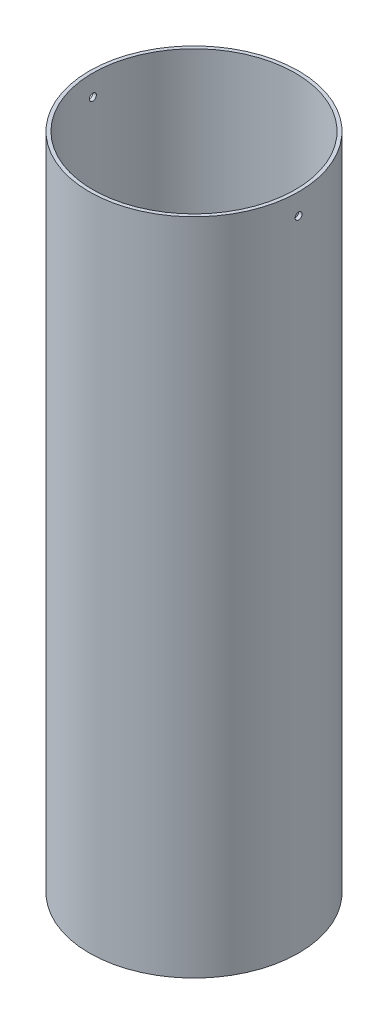
from build123d import *

# Parameters (mm, degrees)
SKETCH1_W               = 3.175
SKETCH1_H               = 600
CUT_EXTRUDE1_REACH      = 638.681
CUT_EXTRUDE1_END_RADIUS = 92.075
SKETCH3_R               = 3.175
CIRPATTERN1_COUNT       = 2


with BuildPart() as part:
    # Sketch1 → Revolve1 (revolve)
    with BuildSketch(Plane.XY):
        with Locations((93.6625, 300)):
            Rectangle(SKETCH1_W, SKETCH1_H)
    revolve(axis=Axis((0, 0, 0), (0, 1, 0)))

    # Cut-Extrude1: up to this cylinder (the profile starts outside it)
    cut_extrude1_end = Plane(origin=(0, 580.95, 0), z_dir=(0, -1, 0)) * Cylinder(CUT_EXTRUDE1_END_RADIUS, 1462.512, mode=Mode.PRIVATE)
    # Sketch3 → Cut-Extrude1 (cut, up to the surface)
    with BuildSketch(Plane(origin=(95.25, 0, 0), x_dir=(0, 0, -1), z_dir=(1, 0, 0)), mode=Mode.PRIVATE) as cut_extrude1_sk1:
        with Locations((0, 580.95)):
            Circle(SKETCH3_R)
    cut_extrude1_tool1 = extrude(cut_extrude1_sk1.sketch, amount=-CUT_EXTRUDE1_REACH, mode=Mode.PRIVATE) - cut_extrude1_end
    cut_extrude1 = cut_extrude1_tool1.solids().sort_by_distance((95.25, 580.95, 0))[0]
    add(cut_extrude1, mode=Mode.SUBTRACT)

    # CirPattern1: Cut-Extrude1 ×2 about axis
    cirpattern1_axis = Axis((0, 600, 0), (0, -1, 0))
    for i in range(1, CIRPATTERN1_COUNT):
        add(cut_extrude1.rotate(cirpattern1_axis, i * 360 / CIRPATTERN1_COUNT), mode=Mode.SUBTRACT)


solid = part.part
